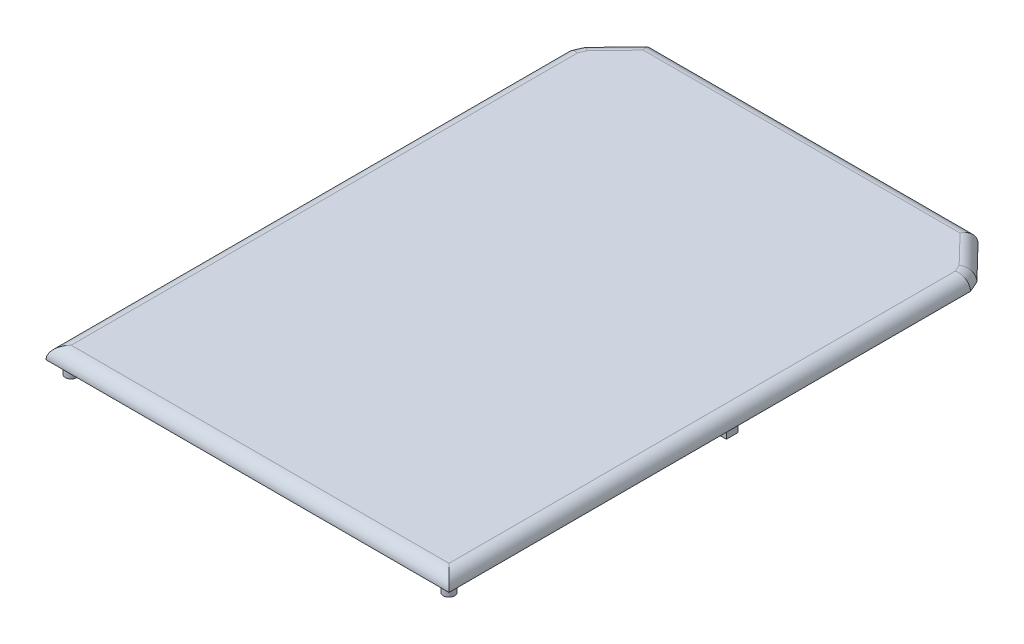
from build123d import *

# Parameters (mm, degrees)
BOSS_EXTRUDE1_DEPTH = 5
FILLET1_R           = 5
SKETCH3_R           = 2.3
BOSS_EXTRUDE2_DEPTH = 5


with BuildPart() as part:
    # Lid → Boss-Extrude1 (new body)
    with BuildSketch(Plane(origin=(0, 0, 0), x_dir=(1, 0, 0), z_dir=(0, 1, 0))):
        Polygon((-80, -175), (80, -175), (80, 30), (80, 32.01), (78.04, 36.53), (65, 50), (-65, 50), (-78.04, 36.53), (-80, 32.01), (-80, 30), align=None)
    extrude(amount=BOSS_EXTRUDE1_DEPTH)

    # Fillet1
    fillet1_edges = [part.edges().sort_by_distance(p)[0] for p in [
        (0, 5, 175),
        (-79.02, 5, -34.27),
        (-80, 5, 71.495),
        (-71.52, 5, -43.265),
        (0, 5, -50),
        (71.52, 5, -43.265),
        (79.02, 5, -34.27),
        (80, 5, 71.495),
    ]]
    fillet(fillet1_edges, radius=FILLET1_R - 0.0001)  # a hair under: the kernel refuses the full size

    # Sketch3 → Boss-Extrude2 (add)
    with BuildSketch(Plane(origin=(0, 0, 0), x_dir=(1, 0, 0), z_dir=(0, 1, 0))):
        with Locations(Location((-62.5, 40, 0), (0, 0, 270))):
            Circle(SKETCH3_R)
        with Locations(Location((62.5, 40, 0), (0, 0, 270))):
            Circle(SKETCH3_R)
        with Locations(Location((75, -170, 0), (0, 0, 270))):
            Circle(SKETCH3_R)
        with Locations(Location((-75, -170, 0), (0, 0, 270))):
            Circle(SKETCH3_R)
        Polygon((-77.4, -57.7), (-77.4, -62.3), (-75.1, -62.3), (-75.1, -60), (-75.1, -57.7), align=None)
        Polygon((75.1, -57.7), (77.4, -57.7), (77.4, -62.3), (75.1, -62.3), (75.1, -60), align=None)
    extrude(amount=-BOSS_EXTRUDE2_DEPTH)


solid = part.part
